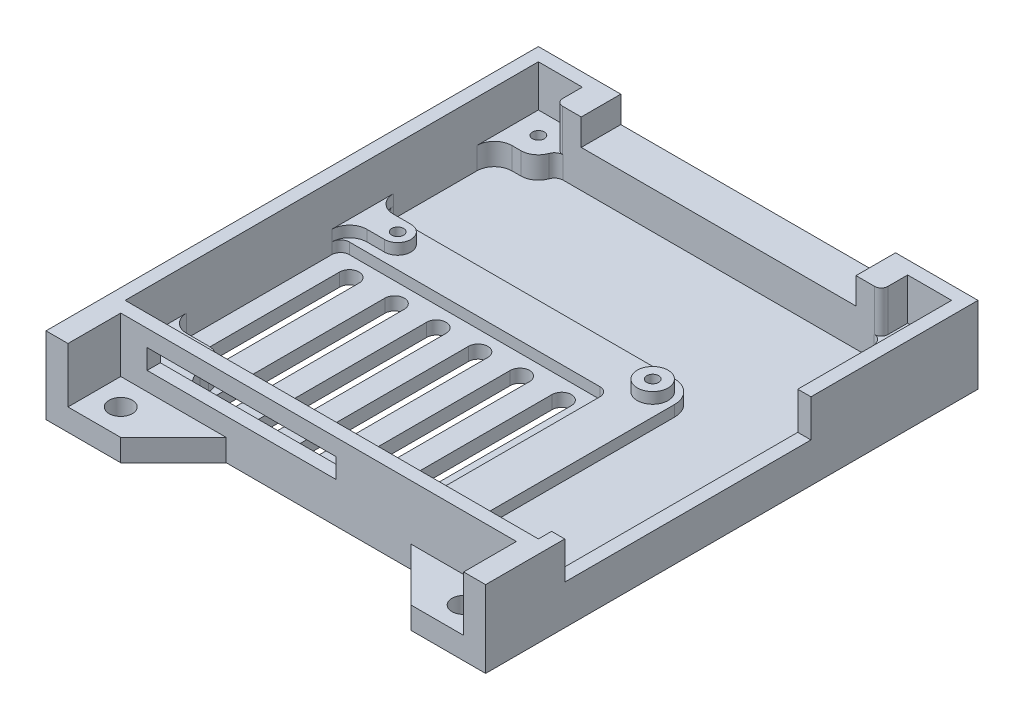
from build123d import *

# Parameters (mm, degrees)
STOCK_D_1_OUTLINE_W     = 100
STOCK_D_1_OUTLINE_H     = 100
STOCK_D_1_DEPTH         = 3
STOCK_D_1_START         = 3
STOCK_D_1_2_OUTLINE_W   = 100
STOCK_D_1_2_OUTLINE_H   = 100
STOCK_D_1_2_OUTLINE_W_2 = 94
STOCK_D_1_2_OUTLINE_H_2 = 94
STOCK_D_1_2_DEPTH       = 14.5
SKETCH1_W               = 10
SKETCH1_H               = 10
BOSS_EXTRUDE1_DEPTH     = 5
CUT_EXTRUDE1_DEPTH      = 143.162758836
CUT_EXTRUDE1_DEPTH_BACK = 143.162758836
SKETCH3_R               = 1.35
SKETCH22_W              = 3
SKETCH22_H              = 10
BOSS_EXTRUDE7_DEPTH     = 5
FILLET8_R               = 4
BOSS_EXTRUDE5_DEPTH     = 2.5
SKETCH14_R              = 3.5
BOSS_EXTRUDE6_DEPTH     = 2.5
CUT_EXTRUDE2_REACH      = 144.5
SKETCH5_W               = 62.5
SKETCH5_H               = 6
SKETCH11_W              = 62.5
SKETCH11_H              = 6
BOSS_EXTRUDE3_DEPTH     = 8.5
SKETCH13_W              = 5.75
SKETCH13_H              = 6
BOSS_EXTRUDE4_DEPTH     = 14.5
SKETCH16_R              = 1.35
CUT_EXTRUDE3_DEPTH      = 8
CUT_EXTRUDE4_REACH      = 144.5
SKETCH17_W              = 43
SKETCH17_H              = 4.5
CUT_EXTRUDE5_REACH      = 144.5
SKETCH18_W              = 56
SKETCH18_H              = 8.5
FILLET10_R              = 2
FILLET11_R              = 2
FILLET13_R              = 1.5
FILLET14_R              = 4
CUT_EXTRUDE7_REACH      = 144.163
SKETCH23_W              = 12
SKETCH23_H              = 12
BOSS_EXTRUDE8_DEPTH     = 5
SKETCH24_R              = 2.65
CUT_EXTRUDE8_DEPTH      = 151.666021385
SKETCH26_W              = 5
SKETCH26_H              = 12
BOSS_EXTRUDE9_DEPTH     = 17.5
CHAMFER3_SIZE           = 12


with BuildPart() as part:
    # Stock-Dėžė-1: read off the stored shape, not the designer's step
    # Stock-Dėžė-1 outline → Stock-Dėžė-1 (new body)
    with BuildSketch(Plane(origin=(0, 0, 0), x_dir=(1, 0, 0), z_dir=(0, 1, 0))):
        with Locations((50, -50)):
            Rectangle(STOCK_D_1_OUTLINE_W, STOCK_D_1_OUTLINE_H)
    extrude(amount=STOCK_D_1_DEPTH)

    # Stock-D_-1 2 outline → Stock-D_-1 2 (add)
    with BuildSketch(Plane(origin=(0, 0, 0), x_dir=(1, 0, 0), z_dir=(0, 1, 0)).offset(STOCK_D_1_START)):
        with Locations((50, -50)):
            Rectangle(STOCK_D_1_2_OUTLINE_W, STOCK_D_1_2_OUTLINE_H)
        with Locations((50, -50)):
            Rectangle(STOCK_D_1_2_OUTLINE_W_2, STOCK_D_1_2_OUTLINE_H_2, mode=Mode.SUBTRACT)
    extrude(amount=STOCK_D_1_2_DEPTH)

    # Sketch1 → Boss-Extrude1 (add)
    with BuildSketch(Plane(origin=(0, 3, 0), x_dir=(1, 0, 0), z_dir=(0, 1, 0))):
        with Locations((8, -8)):
            Rectangle(SKETCH1_W, SKETCH1_H)
        with Locations((92, -8)):
            Rectangle(SKETCH1_W, SKETCH1_H)
        with Locations((11, -92)):
            Rectangle(SKETCH1_W, SKETCH1_H)
    extrude(amount=BOSS_EXTRUDE1_DEPTH)

    # Sketch3 → Cut-Extrude1 (cut, two sides: drawn at the far end of the back side and taken through both)
    with BuildSketch(Plane(origin=(0, 3, 0), x_dir=(1, 0, 0), z_dir=(0, 1, 0)).offset(-CUT_EXTRUDE1_DEPTH_BACK)):
        with Locations(Location((8, -8, 0), (0, 0, 270))):
            Circle(SKETCH3_R)
        with Locations(Location((11, -92, 0), (0, 0, 90))):
            Circle(SKETCH3_R)
        with Locations(Location((92, -8, 0), (0, 0, 90))):
            Circle(SKETCH3_R)
    extrude(amount=CUT_EXTRUDE1_DEPTH + CUT_EXTRUDE1_DEPTH_BACK, mode=Mode.SUBTRACT)

    # Sketch22 → Boss-Extrude7 (add)
    with BuildSketch(Plane(origin=(0, 3, 0), x_dir=(1, 0, 0), z_dir=(0, 1, 0))):
        with Locations((4.5, -92)):
            Rectangle(SKETCH22_W, SKETCH22_H)
    extrude(amount=BOSS_EXTRUDE7_DEPTH)

    # Fillet8
    fillet8_edges = [part.edges().sort_by_distance(p)[0] for p in [
        (3, 5.5, 13),
        (13, 5.5, 13),
        (97, 5.5, 13),
        (87, 5.5, 13),
        (16, 5.5, 97),
        (16, 5.5, 87),
        (3, 5.5, 87),
    ]]
    fillet(fillet8_edges, radius=FILLET8_R)

    # Sketch6 → Boss-Extrude5 (add)
    with BuildSketch(Plane(origin=(0, 3, 0), x_dir=(1, 0, 0), z_dir=(0, 1, 0))):
        with BuildLine():
            Line((64, -92), (64, -97))
            Line((64, -97), (74, -97))
            Line((74, -97), (74, -92))
            Line((74, -92), (74, -43))
            ThreePointArc((74, -43), (72.535533906, -39.464466094), (69, -38))
            Line((69, -38), (8, -38))
            Line((8, -38), (3, -38))
            Line((3, -38), (3, -48))
            Line((3, -48), (64, -48))
            Line((64, -48), (64, -92))
        make_face()
    extrude(amount=BOSS_EXTRUDE5_DEPTH)

    # Sketch14 → Boss-Extrude6 (add)
    with BuildSketch(Plane(origin=(0, 5.5, 0), x_dir=(1, 0, 0), z_dir=(0, 1, 0))):
        with Locations(Location((69, -43, 0), (0, 0, 270))):
            Circle(SKETCH14_R)
        with BuildLine():
            Line((11, -40), (3, -40))
            Line((3, -40), (3, -46))
            Line((3, -46), (11, -46))
            ThreePointArc((11, -46), (14, -43), (11, -40))
        make_face()
        with BuildLine():
            Line((72, -92), (72, -97))
            Line((72, -97), (66, -97))
            Line((66, -97), (66, -92))
            ThreePointArc((66, -92), (69, -89), (72, -92))
        make_face()
    extrude(amount=BOSS_EXTRUDE6_DEPTH)

    # Sketch5 → Cut-Extrude2 (cut, up to next)
    with BuildSketch(Plane(origin=(0, 0, 0), x_dir=(-1, 0, 0), z_dir=(0, 0, -1)), mode=Mode.PRIVATE) as cut_extrude2_sk1:
        with Locations((-50, 14.5)):
            Rectangle(SKETCH5_W, SKETCH5_H)
    cut_extrude2_tool1 = extrude(cut_extrude2_sk1.sketch, amount=-CUT_EXTRUDE2_REACH, mode=Mode.PRIVATE) & part.part
    add(cut_extrude2_tool1.solids().sort_by_distance((50, 14.5, 0))[0], mode=Mode.SUBTRACT)

    # Sketch11 → Boss-Extrude3 (add)
    with BuildSketch(Plane(origin=(0, 3, 0), x_dir=(1, 0, 0), z_dir=(0, 1, 0))):
        with Locations((50, -6)):
            Rectangle(SKETCH11_W, SKETCH11_H)
    extrude(amount=BOSS_EXTRUDE3_DEPTH)

    # Sketch13 → Boss-Extrude4 (add)
    with BuildSketch(Plane(origin=(0, 3, 0), x_dir=(1, 0, 0), z_dir=(0, 1, 0))):
        with Locations((15.875, -6)):
            Rectangle(SKETCH13_W, SKETCH13_H)
        with Locations((84.125, -6)):
            Rectangle(SKETCH13_W, SKETCH13_H)
    extrude(amount=BOSS_EXTRUDE4_DEPTH)

    # Sketch16 → Cut-Extrude3 (cut)
    with BuildSketch(Plane(origin=(0, 8, 0), x_dir=(1, 0, 0), z_dir=(0, 1, 0))):
        with Locations(Location((69, -43, 0), (0, 0, 270))):
            Circle(SKETCH16_R)
        with Locations(Location((11, -43, 0), (0, 0, 270))):
            Circle(SKETCH16_R)
        with Locations(Location((69, -92, 0), (0, 0, 270))):
            Circle(SKETCH16_R)
    extrude(amount=-CUT_EXTRUDE3_DEPTH, mode=Mode.SUBTRACT)

    # Sketch17 → Cut-Extrude4 (cut, up to next)
    with BuildSketch(Plane.XY.offset(100), mode=Mode.PRIVATE) as cut_extrude4_sk1:
        with Locations((32.5, 11.45)):
            Rectangle(SKETCH17_W, SKETCH17_H)
    cut_extrude4_tool1 = extrude(cut_extrude4_sk1.sketch, amount=-CUT_EXTRUDE4_REACH, mode=Mode.PRIVATE) & part.part
    add(cut_extrude4_tool1.solids().sort_by_distance((32.5, 11.45, 100))[0], mode=Mode.SUBTRACT)

    # Sketch18 → Cut-Extrude5 (cut, up to next)
    with BuildSketch(Plane(origin=(100, 0, 0), x_dir=(0, 0, -1), z_dir=(1, 0, 0)), mode=Mode.PRIVATE) as cut_extrude5_sk1:
        with Locations((-66, 13.25)):
            Rectangle(SKETCH18_W, SKETCH18_H)
    cut_extrude5_tool1 = extrude(cut_extrude5_sk1.sketch, amount=-CUT_EXTRUDE5_REACH, mode=Mode.PRIVATE) & part.part
    add(cut_extrude5_tool1.solids().sort_by_distance((100, 13.25, 66))[0], mode=Mode.SUBTRACT)

    # Fillet10
    fillet10_edges = [part.edges().sort_by_distance(p)[0] for p in [
        (87, 5.5, 9),
        (13, 5.5, 9),
    ]]
    fillet(fillet10_edges, radius=FILLET10_R)

    # Fillet11
    fillet11_edges = [part.edges().sort_by_distance(p)[0] for p in [
        (64, 4.25, 48),
        (64, 4.25, 97),
        (74, 4.25, 97),
        (3, 4.25, 38),
        (3, 4.25, 48),
    ]]
    fillet(fillet11_edges, radius=FILLET11_R)

    # Fillet13
    fillet13_edges = [part.edges().sort_by_distance(p)[0] for p in [
        (13, 12.75, 9),
        (87, 12.75, 9),
    ]]
    fillet(fillet13_edges, radius=FILLET13_R)

    # Fillet14
    fillet14_edges = [part.edges().sort_by_distance(p)[0] for p in [
        (72, 6.75, 97),
        (66, 6.75, 97),
        (3, 6.75, 40),
        (3, 6.75, 46),
    ]]
    fillet(fillet14_edges, radius=FILLET14_R)

    # Sketch21 → Cut-Extrude7 (cut, up to next)
    with BuildSketch(Plane(origin=(0, 3, 0), x_dir=(1, 0, 0), z_dir=(0, 1, 0)), mode=Mode.PRIVATE) as cut_extrude7_sk1:
        with BuildLine():
            Line((60, -52.5), (60, -92.5))
            ThreePointArc((60, -92.5), (57.8, -94.7), (55.6, -92.5))
            Line((55.6, -92.5), (55.6, -52.5))
            ThreePointArc((55.6, -52.5), (57.8, -50.3), (60, -52.5))
        make_face()
    cut_extrude7_tool1 = extrude(cut_extrude7_sk1.sketch, amount=-CUT_EXTRUDE7_REACH, mode=Mode.PRIVATE) & part.part
    # Sketch21 → Cut-Extrude7 (cut, up to next)
    with BuildSketch(Plane(origin=(0, 3, 0), x_dir=(1, 0, 0), z_dir=(0, 1, 0)), mode=Mode.PRIVATE) as cut_extrude7_sk2:
        with BuildLine():
            Line((46.1, -52.5), (46.1, -92.5))
            ThreePointArc((46.1, -92.5), (48.3, -94.7), (50.5, -92.5))
            Line((50.5, -92.5), (50.5, -52.5))
            ThreePointArc((50.5, -52.5), (48.3, -50.3), (46.1, -52.5))
        make_face()
    cut_extrude7_tool2 = extrude(cut_extrude7_sk2.sketch, amount=-CUT_EXTRUDE7_REACH, mode=Mode.PRIVATE) & part.part
    # Sketch21 → Cut-Extrude7 (cut, up to next)
    with BuildSketch(Plane(origin=(0, 3, 0), x_dir=(1, 0, 0), z_dir=(0, 1, 0)), mode=Mode.PRIVATE) as cut_extrude7_sk3:
        with BuildLine():
            Line((36.6, -52.5), (36.6, -92.5))
            ThreePointArc((36.6, -92.5), (38.8, -94.7), (41, -92.5))
            Line((41, -92.5), (41, -52.5))
            ThreePointArc((41, -52.5), (38.8, -50.3), (36.6, -52.5))
        make_face()
    cut_extrude7_tool3 = extrude(cut_extrude7_sk3.sketch, amount=-CUT_EXTRUDE7_REACH, mode=Mode.PRIVATE) & part.part
    # Sketch21 → Cut-Extrude7 (cut, up to next)
    with BuildSketch(Plane(origin=(0, 3, 0), x_dir=(1, 0, 0), z_dir=(0, 1, 0)), mode=Mode.PRIVATE) as cut_extrude7_sk4:
        with BuildLine():
            Line((27.1, -52.5), (27.1, -92.5))
            ThreePointArc((27.1, -92.5), (29.3, -94.7), (31.5, -92.5))
            Line((31.5, -92.5), (31.5, -52.5))
            ThreePointArc((31.5, -52.5), (29.3, -50.3), (27.1, -52.5))
        make_face()
    cut_extrude7_tool4 = extrude(cut_extrude7_sk4.sketch, amount=-CUT_EXTRUDE7_REACH, mode=Mode.PRIVATE) & part.part
    # Sketch21 → Cut-Extrude7 (cut, up to next)
    with BuildSketch(Plane(origin=(0, 3, 0), x_dir=(1, 0, 0), z_dir=(0, 1, 0)), mode=Mode.PRIVATE) as cut_extrude7_sk5:
        with BuildLine():
            Line((17.6, -52.5), (17.6, -92.5))
            ThreePointArc((17.6, -92.5), (19.8, -94.7), (22, -92.5))
            Line((22, -92.5), (22, -52.5))
            ThreePointArc((22, -52.5), (19.8, -50.3), (17.6, -52.5))
        make_face()
    cut_extrude7_tool5 = extrude(cut_extrude7_sk5.sketch, amount=-CUT_EXTRUDE7_REACH, mode=Mode.PRIVATE) & part.part
    # Sketch21 → Cut-Extrude7 (cut, up to next)
    with BuildSketch(Plane(origin=(0, 3, 0), x_dir=(1, 0, 0), z_dir=(0, 1, 0)), mode=Mode.PRIVATE) as cut_extrude7_sk6:
        with BuildLine():
            Line((7.3, -52.5), (7.3, -82.5))
            ThreePointArc((7.3, -82.5), (9.5, -84.7), (11.7, -82.5))
            Line((11.7, -82.5), (11.7, -52.5))
            ThreePointArc((11.7, -52.5), (9.5, -50.3), (7.3, -52.5))
        make_face()
    cut_extrude7_tool6 = extrude(cut_extrude7_sk6.sketch, amount=-CUT_EXTRUDE7_REACH, mode=Mode.PRIVATE) & part.part
    add(cut_extrude7_tool1.solids().sort_by_distance((57.8, 3, 72.5))[0], mode=Mode.SUBTRACT)
    add(cut_extrude7_tool2.solids().sort_by_distance((48.3, 3, 72.5))[0], mode=Mode.SUBTRACT)
    add(cut_extrude7_tool3.solids().sort_by_distance((38.8, 3, 72.5))[0], mode=Mode.SUBTRACT)
    add(cut_extrude7_tool4.solids().sort_by_distance((29.3, 3, 72.5))[0], mode=Mode.SUBTRACT)
    add(cut_extrude7_tool5.solids().sort_by_distance((19.8, 3, 72.5))[0], mode=Mode.SUBTRACT)
    add(cut_extrude7_tool6.solids().sort_by_distance((9.5, 3, 67.5))[0], mode=Mode.SUBTRACT)

    # Sketch23 → Boss-Extrude8 (add)
    with BuildSketch(Plane.XZ):
        with Locations((11, 106)):
            Rectangle(SKETCH23_W, SKETCH23_H)
        with Locations((89, 106)):
            Rectangle(SKETCH23_W, SKETCH23_H)
    extrude(amount=-BOSS_EXTRUDE8_DEPTH)

    # Sketch24 → Cut-Extrude8 (cut, through all)
    with BuildSketch(Plane(origin=(0, 5, 0), x_dir=(1, 0, 0), z_dir=(0, 1, 0))):
        with Locations(Location((11, -106, 0), (0, 0, 270))):
            Circle(SKETCH24_R)
        with Locations(Location((89, -106, 0), (0, 0, 270))):
            Circle(SKETCH24_R)
    extrude(amount=-CUT_EXTRUDE8_DEPTH, mode=Mode.SUBTRACT)

    # Sketch26 → Boss-Extrude9 (add)
    with BuildSketch(Plane.XZ):
        with Locations((2.5, 106)):
            Rectangle(SKETCH26_W, SKETCH26_H)
        with Locations((97.5, 106)):
            Rectangle(SKETCH26_W, SKETCH26_H)
    extrude(amount=-BOSS_EXTRUDE9_DEPTH)

    # Chamfer3
    chamfer3_edges = [part.edges().sort_by_distance(p)[0] for p in [
        (17, 2.5, 100),
        (83, 2.5, 100),
    ]]
    chamfer(chamfer3_edges, length=CHAMFER3_SIZE - 0.0001)  # a hair under: the kernel refuses the full size


solid = part.part
